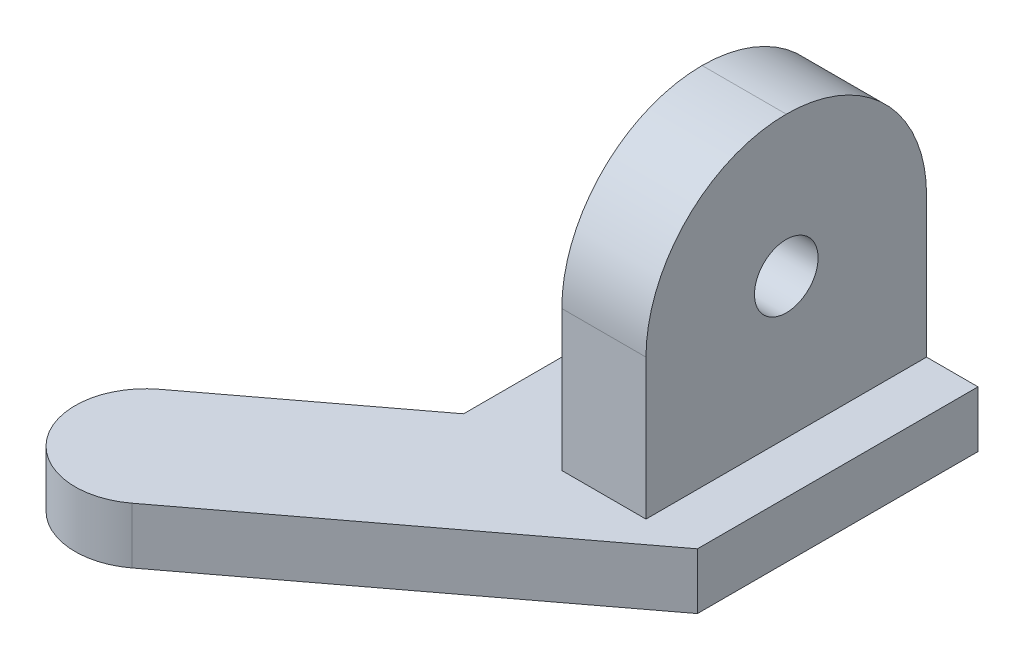
from build123d import *

# Parameters (mm, degrees)
BOSS_EXTRUDE1_DEPTH = 3
SKETCH2_W           = 4.5
SKETCH2_H           = 15
BOSS_EXTRUDE2_DEPTH = 15
CUT_EXTRUDE1_REACH  = 36.599
SKETCH3_R           = 1.7
FILLET1_R           = 7.5


with BuildPart() as part:
    # Sketch1 → Boss-Extrude1 (new body)
    with BuildSketch(Plane(origin=(0, 0, 0), x_dir=(1, 0, 0), z_dir=(0, 1, 0))):
        with BuildLine():
            Line((-6.25, -7.5), (-15.518088002, -14.494783398))
            ThreePointArc((-15.518088002, -14.494783398), (-16.255216602, -19.768088002), (-10.981911998, -20.505216602))
            Line((-10.981911998, -20.505216602), (6.25, -7.5))
            Line((6.25, -7.5), (6.25, 7.5))
            Line((6.25, 7.5), (-6.25, 7.5))
            Line((-6.25, 7.5), (-6.25, -7.5))
        make_face()
    extrude(amount=BOSS_EXTRUDE1_DEPTH)

    # Sketch2 → Boss-Extrude2 (add)
    with BuildSketch(Plane(origin=(0, 3, 0), x_dir=(1, 0, 0), z_dir=(0, 1, 0))):
        with Locations((1.25, 0)):
            Rectangle(SKETCH2_W, SKETCH2_H)
    extrude(amount=BOSS_EXTRUDE2_DEPTH)

    # Sketch3 → Cut-Extrude1 (cut, up to next)
    with BuildSketch(Plane(origin=(3.5, 0, 0), x_dir=(0, 0, -1), z_dir=(1, 0, 0)), mode=Mode.PRIVATE) as cut_extrude1_sk1:
        with Locations((0, 10.5)):
            Circle(SKETCH3_R)
    cut_extrude1_tool1 = extrude(cut_extrude1_sk1.sketch, amount=-CUT_EXTRUDE1_REACH, mode=Mode.PRIVATE) & part.part
    add(cut_extrude1_tool1.solids().sort_by_distance((3.5, 10.5, 0))[0], mode=Mode.SUBTRACT)

    # Fillet1
    fillet1_edges = [part.edges().sort_by_distance(p)[0] for p in [
        (1.25, 18, -7.5),
        (1.25, 18, 7.5),
    ]]
    fillet(fillet1_edges, radius=FILLET1_R - 0.0001)  # a hair under: the kernel refuses the full size


solid = part.part
